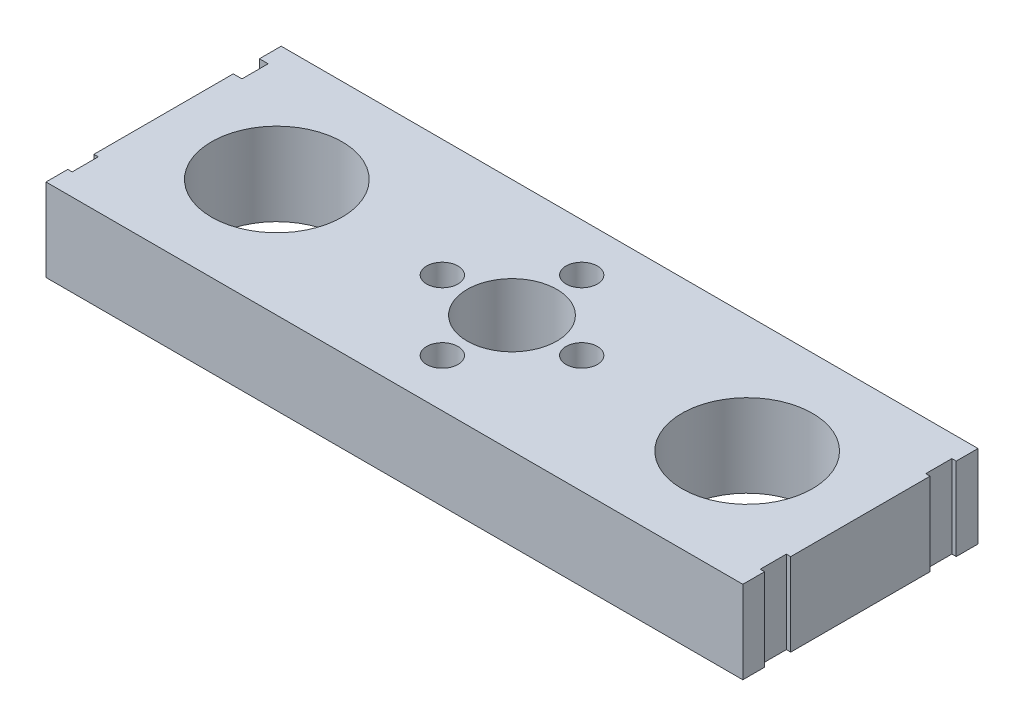
from build123d import *

# Parameters (mm, degrees)
SKETCH_1_W          = 80
SKETCH_1_H          = 27
EXTRUDE_1_DEPTH     = 9.5
SKETCH_3_R          = 7.5
CUT_EXTRUDE_1_DEPTH = 44.272393047
SKETCH_4_R          = 5.15
CUT_EXTRUDE_2_DEPTH = 44.272393047
SKETCH_5_R          = 1.8
CUT_EXTRUDE_3_DEPTH = 44.272393047
SKETCH_7_W          = 0.5
SKETCH_7_H          = 3
SKETCH_7_W_2        = 1
CUT_EXTRUDE_4_DEPTH = 44.272393047


with BuildPart() as part:
    # 草图1 → 凸台-拉伸1 (new body)
    with BuildSketch(Plane(origin=(0, 0, 0), x_dir=(1, 0, 0), z_dir=(0, 1, 0))):
        Rectangle(SKETCH_1_W, SKETCH_1_H)
    extrude(amount=EXTRUDE_1_DEPTH)

    # 草图3 → 切除-拉伸1 (cut, through all)
    with BuildSketch(Plane(origin=(0, 9.5, 0), x_dir=(1, 0, 0), z_dir=(0, 1, 0))):
        with Locations((-27, 0)):
            Circle(SKETCH_3_R)
        with Locations((27, 0)):
            Circle(SKETCH_3_R)
    extrude(amount=-CUT_EXTRUDE_1_DEPTH, mode=Mode.SUBTRACT)

    # 草图4 → 切除-拉伸2 (cut, through all)
    with BuildSketch(Plane(origin=(0, 9.5, 0), x_dir=(1, 0, 0), z_dir=(0, 1, 0))):
        Circle(SKETCH_4_R)
    extrude(amount=-CUT_EXTRUDE_2_DEPTH, mode=Mode.SUBTRACT)

    # 草图5 → 切除-拉伸3 (cut, through all)
    with BuildSketch(Plane(origin=(0, 9.5, 0), x_dir=(1, 0, 0), z_dir=(0, 1, 0))):
        with Locations((8, 0)):
            Circle(SKETCH_5_R)
        with Locations((-8, 0)):
            Circle(SKETCH_5_R)
        with Locations((0, 8)):
            Circle(SKETCH_5_R)
        with Locations((0, -8)):
            Circle(SKETCH_5_R)
    extrude(amount=-CUT_EXTRUDE_3_DEPTH, mode=Mode.SUBTRACT)

    # 草图7 → 切除-拉伸4 (cut, through all)
    with BuildSketch(Plane(origin=(0, 9.5, 0), x_dir=(1, 0, 0), z_dir=(0, 1, 0))):
        with Locations((39.75, 9.501563289)):
            Rectangle(SKETCH_7_W, SKETCH_7_H)
        with Locations((39.75, -9.49986112)):
            Rectangle(SKETCH_7_W, SKETCH_7_H)
        with Locations((-39.5, 9.501563289)):
            Rectangle(SKETCH_7_W_2, SKETCH_7_H)
        with Locations((-39.75, -9.49986112)):
            Rectangle(SKETCH_7_W, SKETCH_7_H)
    extrude(amount=-CUT_EXTRUDE_4_DEPTH, mode=Mode.SUBTRACT)


solid = part.part
